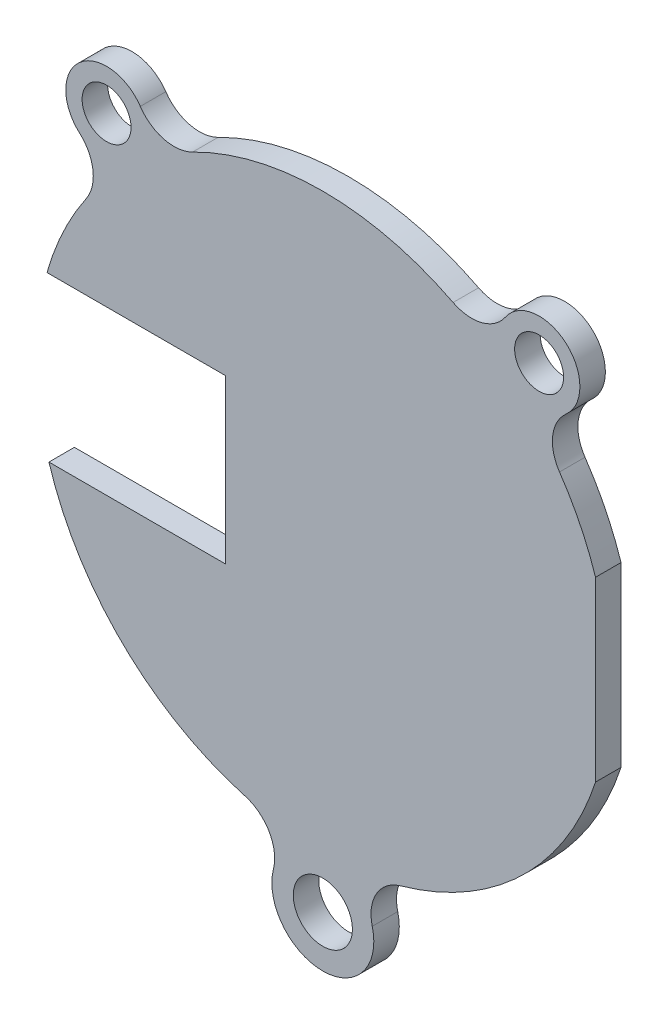
from build123d import *

# Parameters (mm, degrees)
SKETCH1_R           = 1.8415
SKETCH1_R_2         = 1.524
BOSS_EXTRUDE1_DEPTH = 1.5875


with BuildPart() as part:
    # Sketch1 → Boss-Extrude1 (new body)
    with BuildSketch(Plane.XY):
        with BuildLine():
            Line((-6.056265338, 4.8768), (-17.181244816, 4.8768))
            ThreePointArc((-17.181244816, 4.8768), (-16.172322069, 7.578545413), (-14.741706386, 10.082680423))
            ThreePointArc((-14.741706386, 10.082680423), (-14.317457481, 11.828509895), (-15.154421031, 13.418289658))
            ThreePointArc((-15.154421031, 13.418289658), (-15.147832175, 17.227454165), (-11.369129629, 16.746637442))
            ThreePointArc((-11.369129629, 16.746637442), (-9.89949783, 15.713153019), (-8.113736976, 15.910550712))
            ThreePointArc((-8.113736976, 15.910550712), (0, 17.859965052), (8.113736976, 15.910550712))
            ThreePointArc((8.113736976, 15.910550712), (9.89949783, 15.713153019), (11.369129629, 16.746637442))
            ThreePointArc((11.369129629, 16.746637442), (15.147832175, 17.227454165), (15.154421031, 13.418289658))
            ThreePointArc((15.154421031, 13.418289658), (14.317457481, 11.828509895), (14.741706386, 10.082680423))
            ThreePointArc((14.741706386, 10.082680423), (16.025769731, 7.883720963), (16.984058744, 5.5245))
            Line((16.984058744, 5.5245), (16.984058744, -5.5245))
            ThreePointArc((16.984058744, -5.5245), (12.377442365, -12.875452309), (4.850582957, -17.188664772))
            ThreePointArc((4.850582957, -17.188664772), (3.34119056, -18.362373067), (3.078011585, -20.256203417))
            ThreePointArc((3.078011585, -20.256203417), (0, -24.209965052), (-3.078011585, -20.256203417))
            ThreePointArc((-3.078011585, -20.256203417), (-3.34119056, -18.362373067), (-4.850582957, -17.188664772))
            ThreePointArc((-4.850582957, -17.188664772), (-12.468387001, -12.78740307), (-17.060660873, -5.2832))
            Line((-17.060660873, -5.2832), (-6.056265338, -5.2832))
            Line((-6.056265338, -5.2832), (-6.056265338, 4.8768))
        make_face()
        with Locations((0, -21.034965052)):
            Circle(SKETCH1_R, mode=Mode.SUBTRACT)
        with Locations((13.470606702, 15.319965052)):
            Circle(SKETCH1_R_2, mode=Mode.SUBTRACT)
        with Locations((-13.470606702, 15.319965052)):
            Circle(SKETCH1_R_2, mode=Mode.SUBTRACT)
    extrude(amount=BOSS_EXTRUDE1_DEPTH)


solid = part.part
